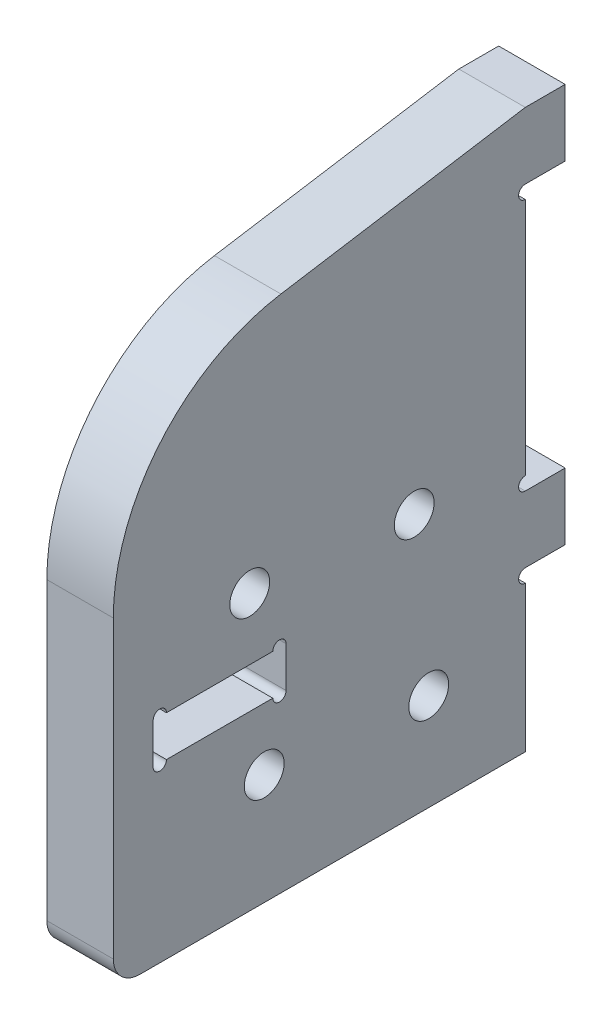
from build123d import *

# Parameters (mm, degrees)
SKETCH1_R           = 1.5
BOSS_EXTRUDE1_DEPTH = 5
SKETCH2_W           = 10
SKETCH2_H           = 3.05
CUT_EXTRUDE1_DEPTH  = 34.136083052
FILLET1_R           = 15
FILLET2_R           = 2
CUT_EXTRUDE2_DEPTH  = 34.136083052


with BuildPart() as part:
    # Sketch1 → Boss-Extrude1 (new body)
    with BuildSketch(Plane(origin=(0, 0, 0), x_dir=(0, 0, -1), z_dir=(1, 0, 0))):
        Polygon((17, 28), (17, 23), (14, 23), (14, 3), (17, 3), (17, -2), (14, -2), (14, -14), (-17, -14), (-17, 23), (14, 28), align=None)
        with Locations((-6.733876165, 6.701112728)):
            Circle(SKETCH1_R, mode=Mode.SUBTRACT)
        with Locations((-5.643042298, -5.67063256)):
            Circle(SKETCH1_R, mode=Mode.SUBTRACT)
        with Locations((6.733876165, -6.701112728)):
            Circle(SKETCH1_R, mode=Mode.SUBTRACT)
        with Locations((5.643042298, 5.67063256)):
            Circle(SKETCH1_R, mode=Mode.SUBTRACT)
    extrude(amount=BOSS_EXTRUDE1_DEPTH)

    # Sketch2 → Cut-Extrude1 (cut, through all)
    with BuildSketch(Plane(origin=(5, 0, 0), x_dir=(0, 0, -1), z_dir=(1, 0, 0))):
        with Locations((-9, 0.525)):
            Rectangle(SKETCH2_W, SKETCH2_H)
    extrude(amount=-CUT_EXTRUDE1_DEPTH, mode=Mode.SUBTRACT)

    # Fillet1
    fillet1_edges = [part.edges().sort_by_distance(p)[0] for p in [
        (2.5, 23, 17),
    ]]
    fillet(fillet1_edges, radius=FILLET1_R)

    # Fillet2
    fillet2_edges = [part.edges().sort_by_distance(p)[0] for p in [
        (2.5, -14, 17),
    ]]
    fillet(fillet2_edges, radius=FILLET2_R)

    # Sketch3 → Cut-Extrude2 (cut, through all)
    with BuildSketch(Plane(origin=(5, 0, 0), x_dir=(0, 0, -1), z_dir=(1, 0, 0))):
        with BuildLine():
            Line((14, 22), (14, 23))
            ThreePointArc((14, 23), (13.5, 22.5), (14, 22))
        make_face()
        with BuildLine():
            Line((14, 3), (14, 4))
            ThreePointArc((14, 4), (13.5, 3.5), (14, 3))
        make_face()
        with BuildLine():
            Line((14, -3), (14, -2))
            ThreePointArc((14, -2), (13.5, -2.5), (14, -3))
        make_face()
        with BuildLine():
            Line((-5, 2.05), (-4, 2.05))
            ThreePointArc((-4, 2.05), (-4.5, 2.55), (-5, 2.05))
        make_face()
        with BuildLine():
            Line((-14, 2.05), (-13, 2.05))
            ThreePointArc((-13, 2.05), (-13.5, 2.55), (-14, 2.05))
        make_face()
        with BuildLine():
            Line((-13, -1), (-14, -1))
            ThreePointArc((-14, -1), (-13.5, -1.5), (-13, -1))
        make_face()
        with BuildLine():
            Line((-4, -1), (-5, -1))
            ThreePointArc((-5, -1), (-4.5, -1.5), (-4, -1))
        make_face()
    extrude(amount=-CUT_EXTRUDE2_DEPTH, mode=Mode.SUBTRACT)


solid = part.part
